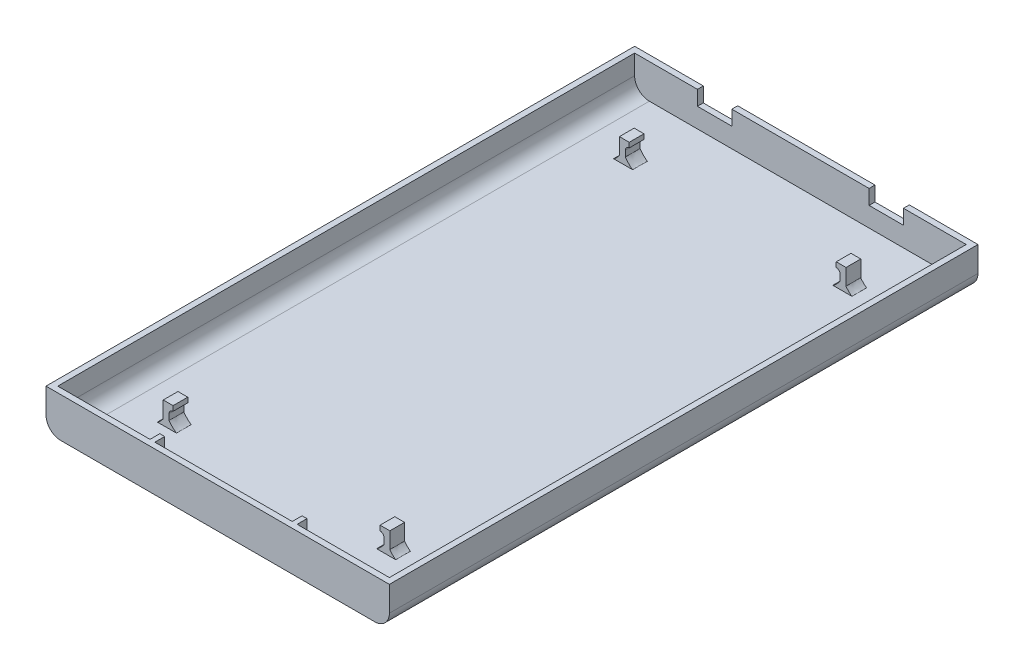
from build123d import *

# Parameters (mm, degrees)
SKETCH1_W           = 70
SKETCH1_H           = 120
BOSS_EXTRUDE1_DEPTH = 1.1
SKETCH2_W           = 70
SKETCH2_H           = 120
SKETCH2_W_2         = 67.6
SKETCH2_H_2         = 117.6
BOSS_EXTRUDE2_DEPTH = 7
SKETCH3_W           = 1.2
SKETCH3_H           = 3
BOSS_EXTRUDE3_DEPTH = 4.5
SKETCH5_W           = 0.8
SKETCH5_H           = 1
BOSS_EXTRUDE4_DEPTH = 3
SKETCH6_W           = 0.8
SKETCH6_H           = 1
BOSS_EXTRUDE5_DEPTH = 3
SKETCH7_W           = 7
SKETCH7_H           = 1.2
CUT_EXTRUDE1_DEPTH  = 3
SKETCH8_W           = 1
SKETCH8_H           = 7
BOSS_EXTRUDE6_DEPTH = 2
FILLET1_SIZE        = 1.5
FILLET2_SIZE        = 1.2
FILLET3_R           = 0.8
FILLET4_R           = 3


# Some blends are built 0.0001 mm under size
with BuildPart() as part:
    # Sketch1 → Boss-Extrude1 (new body)
    with BuildSketch(Plane(origin=(0, 0, 0), x_dir=(1, 0, 0), z_dir=(0, 1, 0))):
        with Locations((35, -60)):
            Rectangle(SKETCH1_W, SKETCH1_H)
    extrude(amount=BOSS_EXTRUDE1_DEPTH)

    # Sketch2 → Boss-Extrude2 (add)
    with BuildSketch(Plane(origin=(0, 1.1, 0), x_dir=(1, 0, 0), z_dir=(0, 1, 0))):
        with Locations((35, -60)):
            Rectangle(SKETCH2_W, SKETCH2_H)
        with Locations((35, -60)):
            Rectangle(SKETCH2_W_2, SKETCH2_H_2, mode=Mode.SUBTRACT)
    extrude(amount=BOSS_EXTRUDE2_DEPTH)

    # Sketch3 → Boss-Extrude3 (add)
    with BuildSketch(Plane(origin=(0, 1.1, 0), x_dir=(1, 0, 0), z_dir=(0, 1, 0))):
        with Locations((57.5, -13.5)):
            Rectangle(SKETCH3_W, SKETCH3_H)
        with Locations((12.5, -13.5)):
            Rectangle(SKETCH3_W, SKETCH3_H)
        with Locations((57.5, -106.5)):
            Rectangle(SKETCH3_W, SKETCH3_H)
        with Locations((12.5, -106.5)):
            Rectangle(SKETCH3_W, SKETCH3_H)
    extrude(amount=BOSS_EXTRUDE3_DEPTH)

    # Sketch5 → Boss-Extrude4 (add)
    with BuildSketch(Plane(origin=(0, 0, 12), x_dir=(-1, 0, 0), z_dir=(0, 0, -1))):
        with Locations((-56.5, 5.1)):
            Rectangle(SKETCH5_W, SKETCH5_H)
        with Locations((-13.5, 5.1)):
            Rectangle(SKETCH5_W, SKETCH5_H)
    extrude(amount=-BOSS_EXTRUDE4_DEPTH)

    # Sketch6 → Boss-Extrude5 (add)
    with BuildSketch(Plane(origin=(0, 0, 105), x_dir=(-1, 0, 0), z_dir=(0, 0, -1))):
        with Locations((-56.5, 5.1)):
            Rectangle(SKETCH6_W, SKETCH6_H)
        with Locations((-13.5, 5.1)):
            Rectangle(SKETCH6_W, SKETCH6_H)
    extrude(amount=-BOSS_EXTRUDE5_DEPTH)

    # Sketch7 → Cut-Extrude1 (cut)
    with BuildSketch(Plane(origin=(0, 8.1, 0), x_dir=(1, 0, 0), z_dir=(0, 1, 0))):
        with Locations((52.5, -0.6)):
            Rectangle(SKETCH7_W, SKETCH7_H)
        with Locations((17.5, -0.6)):
            Rectangle(SKETCH7_W, SKETCH7_H)
    extrude(amount=-CUT_EXTRUDE1_DEPTH, mode=Mode.SUBTRACT)

    # Sketch8 → Boss-Extrude6 (add)
    with BuildSketch(Plane(origin=(0, 0, 118.8), x_dir=(-1, 0, 0), z_dir=(0, 0, -1))):
        with Locations((-49.5, 4.6)):
            Rectangle(SKETCH8_W, SKETCH8_H)
        with Locations((-20.5, 4.6)):
            Rectangle(SKETCH8_W, SKETCH8_H)
    extrude(amount=BOSS_EXTRUDE6_DEPTH)

    # Fillet1
    # a fillet whose section is not a circle: 1.5 mm, written as the material it adds along each edge
    with BuildSketch(Plane(origin=(13.1, 1.1, 15), x_dir=(1, 0, 0), z_dir=(0, 0, -1))) as fillet1_piece_1:
        with BuildLine():
            Bezier((FILLET1_SIZE, 0), (0, 0), (0, -FILLET1_SIZE), weights=[1, 0.111111111, 1])
            Line((0, -FILLET1_SIZE), (0, 0))
            Line((0, 0), (FILLET1_SIZE, 0))
        make_face()
    extrude(amount=3)
    with BuildSketch(Plane(origin=(56.9, 1.1, 15), x_dir=(-1, 0, 0), z_dir=(0, 0, -1)), Plane(origin=(56.9, 1.1, 108), x_dir=(-1, 0, 0), z_dir=(0, 0, -1)), Plane(origin=(13.1, 1.1, 105), x_dir=(1, 0, 0), z_dir=(0, 0, 1))) as fillet1_piece_2:
        with BuildLine():
            Bezier((FILLET1_SIZE, 0), (0, 0), (0, FILLET1_SIZE), weights=[1, 0.111111111, 1])
            Line((0, FILLET1_SIZE), (0, 0))
            Line((0, 0), (FILLET1_SIZE, 0))
        make_face()
    extrude(amount=3)

    # Fillet2
    # a fillet whose section is not a circle: 1.2 mm, written as the material it adds along each edge
    with BuildSketch(Plane(origin=(11.9, 1.1, 12), x_dir=(-1, 0, 0), z_dir=(0, 0, 1)), Plane(origin=(58.1, 1.1, 12), x_dir=(0, 1, 0), z_dir=(0, 0, 1))) as fillet2_piece_1:
        with BuildLine():
            Bezier((FILLET2_SIZE, 0), (0, 0), (0, -FILLET2_SIZE), weights=[1, 0.111111111, 1])
            Line((0, -FILLET2_SIZE), (-FILLET2_SIZE * 0.02, -FILLET2_SIZE))
            Line((-FILLET2_SIZE * 0.02, -FILLET2_SIZE), (-FILLET2_SIZE * 0.02, FILLET2_SIZE * 0.02))
            Line((-FILLET2_SIZE * 0.02, FILLET2_SIZE * 0.02), (FILLET2_SIZE, FILLET2_SIZE * 0.02))
            Line((FILLET2_SIZE, FILLET2_SIZE * 0.02), (FILLET2_SIZE, 0))
        make_face()
    extrude(amount=3)
    with BuildSketch(Plane(origin=(58.1, 1.1, 105), x_dir=(1, 0, 0), z_dir=(0, 0, 1)), Plane(origin=(11.9, 1.1, 108), x_dir=(-1, 0, 0), z_dir=(0, 0, -1))) as fillet2_piece_2:
        with BuildLine():
            Bezier((FILLET2_SIZE, 0), (0, 0), (0, FILLET2_SIZE), weights=[1, 0.111111111, 1])
            Line((0, FILLET2_SIZE), (-FILLET2_SIZE * 0.02, FILLET2_SIZE))
            Line((-FILLET2_SIZE * 0.02, FILLET2_SIZE), (-FILLET2_SIZE * 0.02, -FILLET2_SIZE * 0.02))
            Line((-FILLET2_SIZE * 0.02, -FILLET2_SIZE * 0.02), (FILLET2_SIZE, -FILLET2_SIZE * 0.02))
            Line((FILLET2_SIZE, -FILLET2_SIZE * 0.02), (FILLET2_SIZE, 0))
        make_face()
    extrude(amount=3)

    # Fillet3
    fillet3_edges = [part.edges().sort_by_distance(p)[0] for p in [
        (56.9, 4.6, 106.5),
        (56.9, 4.6, 13.5),
        (13.1, 4.6, 13.5),
        (13.1, 4.6, 106.5),
    ]]
    fillet(fillet3_edges, radius=FILLET3_R - 0.0001)  # a hair under: the kernel refuses the full size

    # Fillet4
    fillet4_edges = [part.edges().sort_by_distance(p)[0] for p in [
        (1.2, 1.1, 60),
        (68.8, 1.1, 60),
        (70, 0, 60),
        (0, 0, 60),
    ]]
    fillet(fillet4_edges, radius=FILLET4_R)


solid = part.part
